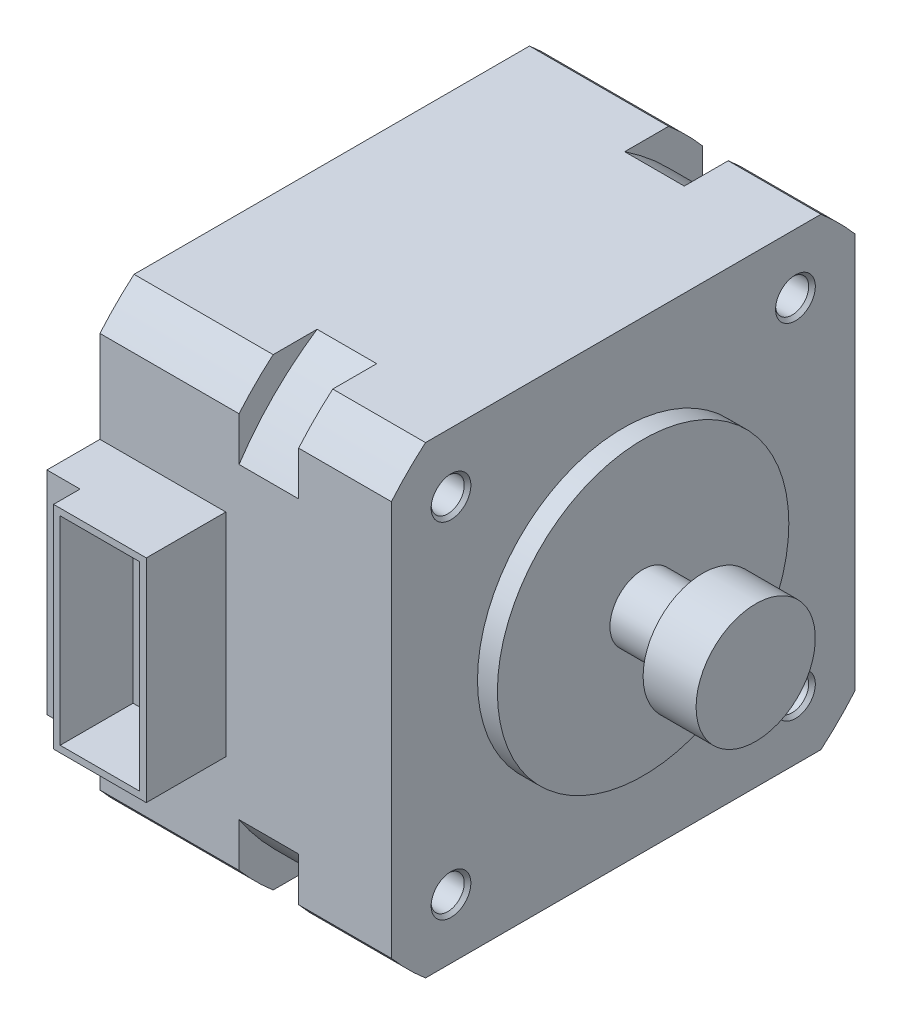
from build123d import *

# Parameters (mm, degrees)
EXTRUDE_1_DEPTH             = 22
THICKEN_START               = 10.5
THICKEN_1_DEPTH             = 4.5
THICKEN_2_DEPTH             = 4.5
SKETCH_2_W                  = 9.5
SKETCH_2_H                  = 16
EXTRUDE_2_DEPTH             = 6
SKETCH_3_W                  = 2.5
SKETCH_3_H                  = 2
CUT_EXTRUDE_1_DEPTH         = 42.067018397
THICKEN_3_DEPTH             = 4.5
THICKEN_4_DEPTH             = 4.5
SKETCH_4_W                  = 6
SKETCH_4_H                  = 15
CUT_EXTRUDE_2_DEPTH         = 5.5
HOLE_WIZARD_2_5_2_5_1_D     = 2.5
HOLE_WIZARD_2_5_2_5_1_DEPTH = 32
HOLE_WIZARD_2_5_2_5_2_D     = 2.5
CHAMFER_1_SIZE              = 0.25


# Read off the part's stored shape, not the designer's step: Вырез-Придать толщину1, Вырез-Придать толщину2, Вырез-Придать толщину3, Вырез-Придать толщину4
with BuildPart() as part:
    # Эскиз1 → Бобышка-Вытянуть1 (new body)
    with BuildSketch(Plane(origin=(0, 0, 0), x_dir=(0, -1, 0), z_dir=(-1, 0, 0))):
        with BuildLine():
            Line((14.924811557, 17.5), (-14.924811557, 17.5))
            ThreePointArc((-14.924811557, 17.5), (-16.263455967, 16.263455967), (-17.5, 14.924811557))
            Line((-17.5, 14.924811557), (-17.5, -14.924811557))
            ThreePointArc((-17.5, -14.924811557), (-16.263455967, -16.263455967), (-14.924811557, -17.5))
            Line((-14.924811557, -17.5), (14.924811557, -17.5))
            ThreePointArc((14.924811557, -17.5), (16.263455967, -16.263455967), (17.5, -14.924811557))
            Line((17.5, -14.924811557), (17.5, 14.924811557))
            ThreePointArc((17.5, 14.924811557), (16.263455967, 16.263455967), (14.924811557, 17.5))
        make_face()
    extrude(amount=-EXTRUDE_1_DEPTH)

    # Вырез-Придать толщину1 outline → Вырез-Придать толщину1 (cut)
    with BuildSketch(Plane.YZ.offset(THICKEN_START)):
        with BuildLine():
            ThreePointArc((-11.608186766, -17.5), (-14.849242405, -14.849242405), (-17.5, -11.608186766))
            Line((-17.5, -11.608186766), (-17.5, -14.924811557))
            ThreePointArc((-17.5, -14.924811557), (-16.263455967, -16.263455967), (-14.924811557, -17.5))
            Line((-14.924811557, -17.5), (-11.608186766, -17.5))
        make_face()
    extrude(amount=THICKEN_1_DEPTH, mode=Mode.SUBTRACT)

    # Вырез-Придать толщину2 outline → Вырез-Придать толщину2 (cut)
    with BuildSketch(Plane.YZ.offset(THICKEN_START)):
        with BuildLine():
            ThreePointArc((-17.5, 11.608186766), (-14.849242405, 14.849242405), (-11.608186766, 17.5))
            Line((-11.608186766, 17.5), (-14.924811557, 17.5))
            ThreePointArc((-14.924811557, 17.5), (-16.263455967, 16.263455967), (-17.5, 14.924811557))
            Line((-17.5, 14.924811557), (-17.5, 11.608186766))
        make_face()
    extrude(amount=THICKEN_2_DEPTH, mode=Mode.SUBTRACT)

    # Эскиз2 → Бобышка-Вытянуть2 (add)
    with BuildSketch(Plane.XY.offset(17.5)):
        with Locations((4.75, 0)):
            Rectangle(SKETCH_2_W, SKETCH_2_H)
    extrude(amount=EXTRUDE_2_DEPTH)

    # Эскиз3 → Вырез-Вытянуть1 (cut, through all)
    with BuildSketch(Plane(origin=(0, 8, 0), x_dir=(-1, 0, 0), z_dir=(0, 1, 0))):
        with Locations((-1.25, 22.5)):
            Rectangle(SKETCH_3_W, SKETCH_3_H)
    extrude(amount=-CUT_EXTRUDE_1_DEPTH, mode=Mode.SUBTRACT)

    # Вырез-Придать толщину3 outline → Вырез-Придать толщину3 (cut)
    with BuildSketch(Plane.YZ.offset(THICKEN_START)):
        with BuildLine():
            ThreePointArc((11.608186766, 17.5), (14.849242405, 14.849242405), (17.5, 11.608186766))
            Line((17.5, 11.608186766), (17.5, 14.924811557))
            ThreePointArc((17.5, 14.924811557), (16.263455967, 16.263455967), (14.924811557, 17.5))
            Line((14.924811557, 17.5), (11.608186766, 17.5))
        make_face()
    extrude(amount=THICKEN_3_DEPTH, mode=Mode.SUBTRACT)

    # Вырез-Придать толщину4 outline → Вырез-Придать толщину4 (cut)
    with BuildSketch(Plane.YZ.offset(THICKEN_START)):
        with BuildLine():
            ThreePointArc((17.5, -11.608186766), (14.849242405, -14.849242405), (11.608186766, -17.5))
            Line((11.608186766, -17.5), (14.924811557, -17.5))
            ThreePointArc((14.924811557, -17.5), (16.263455967, -16.263455967), (17.5, -14.924811557))
            Line((17.5, -14.924811557), (17.5, -11.608186766))
        make_face()
    extrude(amount=THICKEN_4_DEPTH, mode=Mode.SUBTRACT)

    # Эскиз4 → Вырез-Вытянуть2 (cut)
    with BuildSketch(Plane.XY.offset(23.5)):
        with Locations((6, 0)):
            Rectangle(SKETCH_4_W, SKETCH_4_H)
    extrude(amount=-CUT_EXTRUDE_2_DEPTH, mode=Mode.SUBTRACT)

    # Эскиз5 → Повернуть1 (revolve)
    with BuildSketch(Plane(origin=(0, 0, 0), x_dir=(-1, 0, 0), z_dir=(0, 0, -1)), mode=Mode.PRIVATE) as revolve_1_sk:
        Polygon((-32, 4.5), (-32, 0), (-22, 0), (-22, 11), (-23.5, 11), (-23.5, 2.5), (-28, 2.5), (-28, 4.5), align=None)
    revolve(revolve_1_sk.sketch.rotate(Axis((32, 0, 0), (-1, 0, 0)), 270), axis=Axis((32, 0, 0), (-1, 0, 0)))

    # Диаметр отверстия Ø2.5 (2.5)1
    with Locations(Plane.ZY):
        with Locations((-13, -13)):
            Hole(HOLE_WIZARD_2_5_2_5_1_D / 2, depth=HOLE_WIZARD_2_5_2_5_1_DEPTH)

    # Диаметр отверстия Ø2.5 (2.5)2 (through all)
    with Locations(Plane(origin=(22, 0, 0), x_dir=(0, 0, -1), z_dir=(1, 0, 0))):
        with Locations((-13, -13), (13, 13), (-13, 13)):
            Hole(HOLE_WIZARD_2_5_2_5_2_D / 2)

    # Фаска1
    chamfer_1_edges = [part.edges().sort_by_distance(p)[0] for p in [
        (22, -13, -11.75),
        (0, -13, -11.75),
        (22, 13, 11.75),
        (0, 13, 11.75),
        (22, 13, -14.25),
        (0, 13, -14.25),
        (22, -13, 11.75),
        (0, -13, 11.75),
    ]]
    chamfer(chamfer_1_edges, length=CHAMFER_1_SIZE)


solid = part.part
